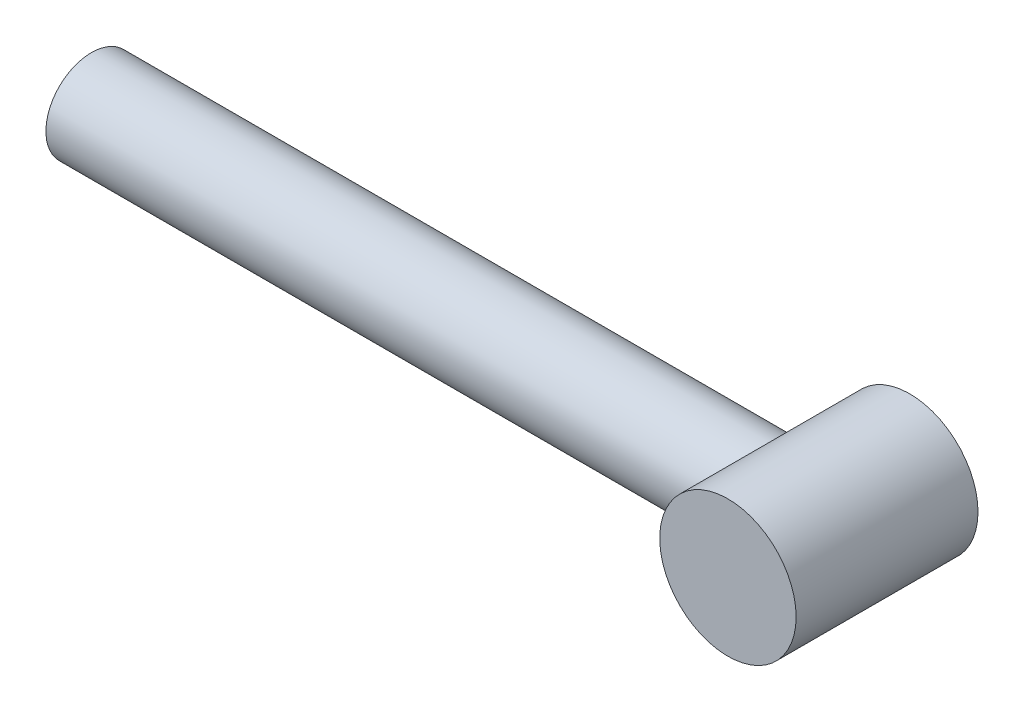
from build123d import *

# Parameters (mm, degrees)
SKETCH1_R                         = 2.38125
BRAKE_CABLE_ANCHOR_CYLINDER_DEPTH = 3.175
SKETCH3_R                         = 1.5875
BRAKE_CABLE_SIMULATED_DEPTH       = 25.4


with BuildPart() as part:
    # Sketch1 → Brake Cable Anchor Cylinder (new, symmetric)
    with BuildSketch(Plane.XY):
        Circle(SKETCH1_R)
    extrude(amount=BRAKE_CABLE_ANCHOR_CYLINDER_DEPTH, both=True)

    # Sketch3 → Brake Cable (simulated) (add)
    with BuildSketch(Plane(origin=(0, 0, 0), x_dir=(0, 0, -1), z_dir=(1, 0, 0))):
        Circle(SKETCH3_R)
    extrude(amount=-BRAKE_CABLE_SIMULATED_DEPTH)


solid = part.part
